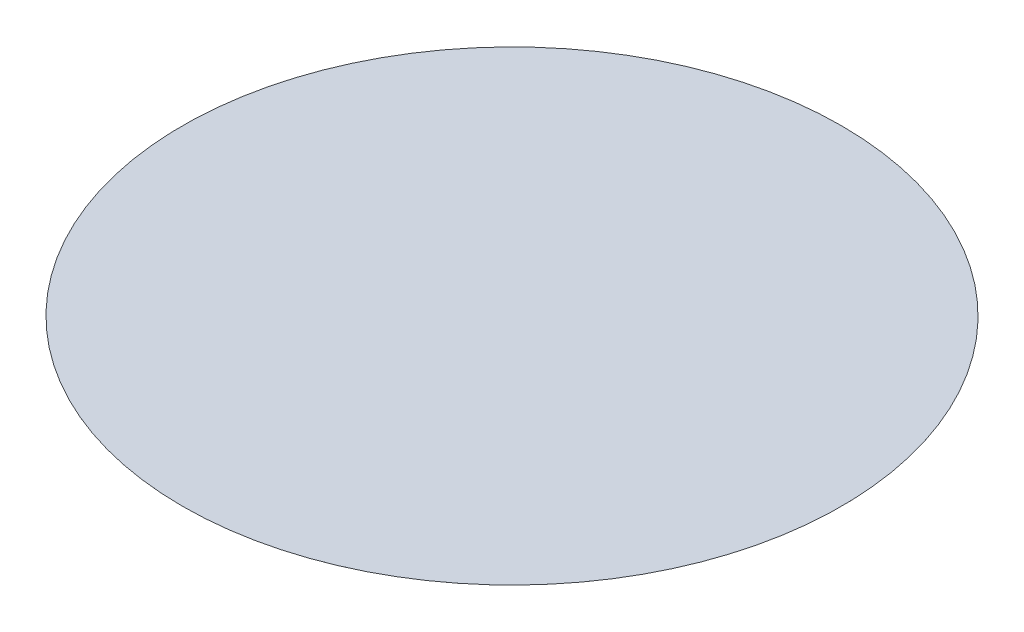
from build123d import *

# Parameters (mm, degrees)
SKETCH1_R           = 10
BOSS_EXTRUDE1_DEPTH = 0.0001


with BuildPart() as part:
    # Sketch1 → Boss-Extrude1 (new body)
    with BuildSketch(Plane(origin=(0, 0, 0), x_dir=(1, 0, 0), z_dir=(0, 1, 0))):
        Circle(SKETCH1_R)
    extrude(amount=BOSS_EXTRUDE1_DEPTH)


solid = part.part
